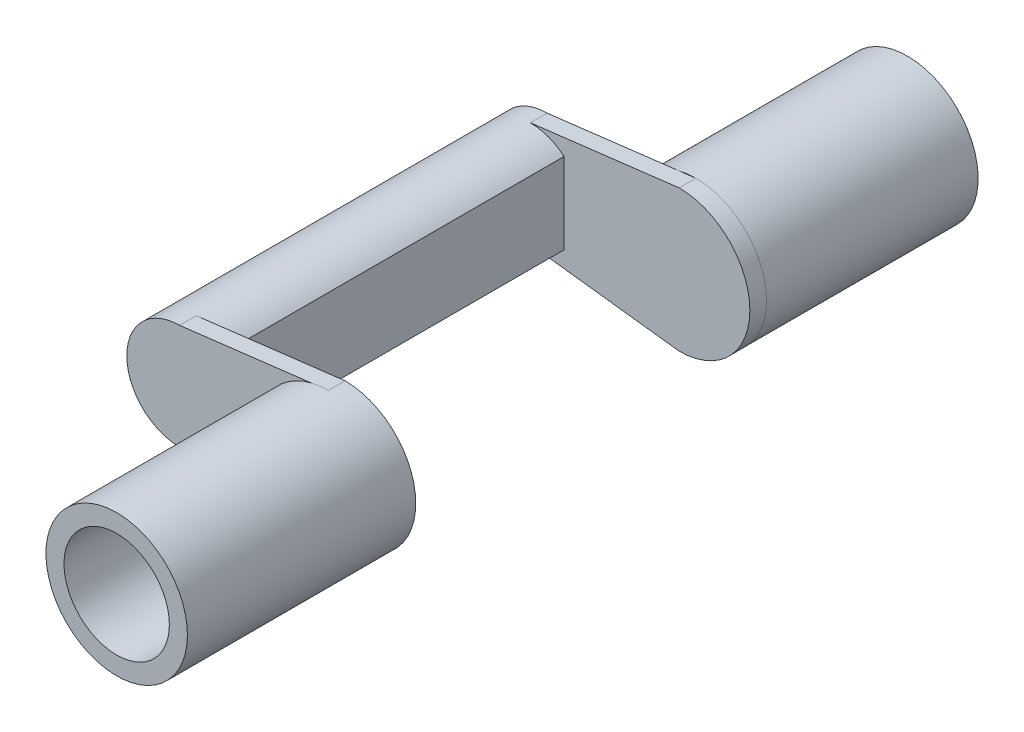
from build123d import *

# Parameters (mm, degrees)
SKETCH5_R      = 7.8
EXTRUDE1_DEPTH = 10
SKETCH6_R      = 12.6875
EXTRUDE2_DEPTH = 3
EXTRUDE3_START = 35
SKETCH7_R      = 12.6875
SKETCH7_R_2    = 9.46
EXTRUDE3_DEPTH = 35
EXTRUDE5_DEPTH = 3
SKETCH10_R     = 4.48
EXTRUDE6_DEPTH = 60
EXTRUDE7_DEPTH = 3
SKETCH12_R     = 7.7
EXTRUDE8_DEPTH = 10
SKETCH13_R     = 12.7
SKETCH13_R_2   = 9.46
EXTRUDE9_DEPTH = 38


with BuildPart() as part:
    # Sketch5 → Extrude1 (new body)
    with BuildSketch(Plane.XY):
        with Locations((-93.65, 0)):
            Circle(SKETCH5_R)
    extrude(amount=-EXTRUDE1_DEPTH)

    # Sketch6 → Extrude2 (add)
    with BuildSketch(Plane.XY):
        with Locations((-93.65, 0)):
            Circle(SKETCH6_R)
    extrude(amount=EXTRUDE2_DEPTH)

    # Sketch7 → Extrude3 (add)
    with BuildSketch(Plane(origin=(0, 0, 0), x_dir=(-1, 0, 0), z_dir=(0, 0, -1)).offset(EXTRUDE3_START)):
        with Locations((93.65, 0)):
            Circle(SKETCH7_R)
        with Locations((93.65, 0)):
            Circle(SKETCH7_R_2, mode=Mode.SUBTRACT)
    extrude(amount=-EXTRUDE3_DEPTH)

    # Sketch9 → Extrude5 (add)
    with BuildSketch(Plane.XY.offset(3)):
        with BuildLine():
            Line((-93.65, -12.7), (-120.3675, -9.46))
            ThreePointArc((-120.3675, -9.46), (-129.8275, 0), (-120.3675, 9.46))
            Line((-120.3675, 9.46), (-93.65, 12.7))
            ThreePointArc((-93.65, 12.7), (-80.95, 0), (-93.65, -12.7))
        make_face()
    extrude(amount=EXTRUDE5_DEPTH)

    # Sketch10 → Extrude6 (add)
    with BuildSketch(Plane.XY.offset(6)):
        with BuildLine():
            Line((-114.3, -7.25789527), (-114.3, 7.25789527))
            ThreePointArc((-114.3, 7.25789527), (-129.8275, 0), (-114.3, -7.25789527))
        make_face()
        with Locations((-120.3675, 0)):
            Circle(SKETCH10_R, mode=Mode.SUBTRACT)
    extrude(amount=EXTRUDE6_DEPTH)

    # Sketch11 → Extrude7 (add)
    with BuildSketch(Plane.XY.offset(66)):
        with BuildLine():
            Line((-93.65, 12.7), (-120.3675, 9.46))
            ThreePointArc((-120.3675, 9.46), (-129.8275, 0), (-120.3675, -9.46))
            Line((-120.3675, -9.46), (-93.65, -12.7))
            ThreePointArc((-93.65, -12.7), (-80.95, 0), (-93.65, 12.7))
        make_face()
    extrude(amount=EXTRUDE7_DEPTH)

    # Sketch12 → Extrude8 (add)
    with BuildSketch(Plane.XY.offset(69)):
        with Locations((-93.65, 0)):
            Circle(SKETCH12_R)
    extrude(amount=EXTRUDE8_DEPTH)

    # Sketch13 → Extrude9 (add)
    with BuildSketch(Plane.XY.offset(69)):
        with Locations((-93.65, 0)):
            Circle(SKETCH13_R)
        with Locations((-93.65, 0)):
            Circle(SKETCH13_R_2, mode=Mode.SUBTRACT)
    extrude(amount=EXTRUDE9_DEPTH)


solid = part.part
